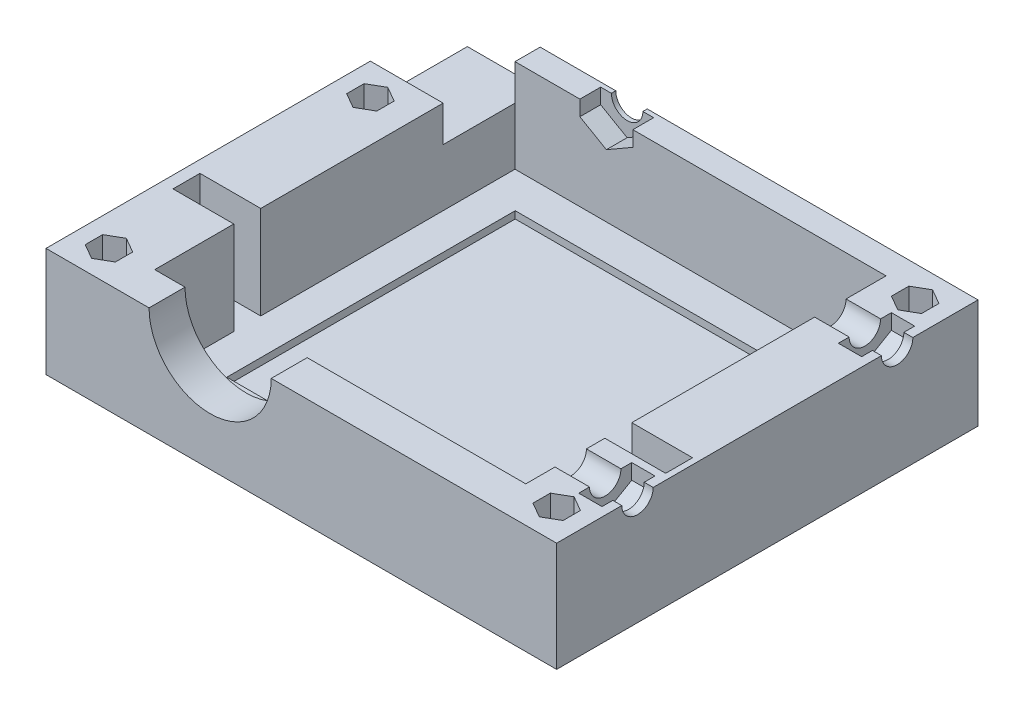
from build123d import *

# Parameters (mm, degrees)
SKETCH1_W              = 56.8325
SKETCH1_H              = 46.9000078
BOSS_EXTRUDE1_DEPTH    = 12.1700036
SKETCH2_W              = 41.2999936
SKETCH2_H              = 40.099996
CUT_EXTRUDE1_DEPTH     = 10.3700072
SKETCH3_W              = 33.3000096
SKETCH3_H              = 32.100012
CUT_EXTRUDE2_DEPTH     = 0.7999984
SKETCH4_W              = 8.1000092
SKETCH4_H              = 10.8000038
CUT_EXTRUDE3_DEPTH     = 3.999992
CUT_EXTRUDE4_START     = -10.3700072
CUT_EXTRUDE4_OUTLINE_W = 6.7650106
CUT_EXTRUDE4_OUTLINE_H = 2.999994
CUT_EXTRUDE4_DEPTH     = 10.3700072
SKETCH6_W              = 6.7650106
SKETCH6_H              = 2.999994
CUT_EXTRUDE5_DEPTH     = 10.3700072
CUT_EXTRUDE6_DEPTH     = 3.999992
CUT_EXTRUDE7_DEPTH     = 5.2500022
SKETCH9_R              = 1.270176684
SKETCH9_R_2            = 1.270176657
CUT_EXTRUDE8_DEPTH     = 38.486962618
CUT_EXTRUDE10_DEPTH    = 2.3114
CUT_EXTRUDE11_DEPTH    = 0.4886198
CUT_EXTRUDE12_DEPTH    = 7.4324972
SKETCH14_W             = 2.5908
SKETCH14_H             = 5.8999882
CUT_EXTRUDE13_DEPTH    = 1.7031716
CUT_EXTRUDE15_DEPTH    = 2.5908


# Read off the part's stored shape, not the designer's step: Cut-Extrude4
with BuildPart() as part:
    # Sketch1 → Boss-Extrude1 (new body)
    with BuildSketch(Plane(origin=(0, 0, 0), x_dir=(1, 0, 0), z_dir=(0, 1, 0))):
        Rectangle(SKETCH1_W, SKETCH1_H)
    extrude(amount=BOSS_EXTRUDE1_DEPTH)

    # Sketch2 → Cut-Extrude1 (cut)
    with BuildSketch(Plane(origin=(0, 12.1700036, 0), x_dir=(1, 0, 0), z_dir=(0, 1, 0))):
        with Locations((0.333756, 0.5999861)):
            Rectangle(SKETCH2_W, SKETCH2_H)
    extrude(amount=-CUT_EXTRUDE1_DEPTH, mode=Mode.SUBTRACT)

    # Sketch3 → Cut-Extrude2 (cut)
    with BuildSketch(Plane(origin=(0, 1.7999964, 0), x_dir=(1, 0, 0), z_dir=(0, 1, 0))):
        with Locations((0.345948, 0.6121781)):
            Rectangle(SKETCH3_W, SKETCH3_H)
    extrude(amount=-CUT_EXTRUDE2_DEPTH, mode=Mode.SUBTRACT)

    # Sketch4 → Cut-Extrude3 (cut)
    with BuildSketch(Plane(origin=(0, 12.1700036, 0), x_dir=(1, 0, 0), z_dir=(0, 1, 0))):
        with Locations((-24.3662454, 18.050002)):
            Rectangle(SKETCH4_W, SKETCH4_H)
    extrude(amount=-CUT_EXTRUDE3_DEPTH, mode=Mode.SUBTRACT)

    # Cut-Extrude4 outline → Cut-Extrude4 (cut)
    with BuildSketch(Plane(origin=(0, 12.1700036, 0), x_dir=(1, 0, 0), z_dir=(0, 1, 0)).offset(CUT_EXTRUDE4_START)):
        with Locations((-23.6987461, -9.1500071)):
            Rectangle(CUT_EXTRUDE4_OUTLINE_W, CUT_EXTRUDE4_OUTLINE_H)
    extrude(amount=CUT_EXTRUDE4_DEPTH, mode=Mode.SUBTRACT)

    # Sketch6 → Cut-Extrude5 (cut)
    with BuildSketch(Plane(origin=(0, 12.1700036, 0), x_dir=(1, 0, 0), z_dir=(0, 1, 0))):
        with Locations((24.3662581, -9.1500071)):
            Rectangle(SKETCH6_W, SKETCH6_H)
    extrude(amount=-CUT_EXTRUDE5_DEPTH, mode=Mode.SUBTRACT)

    # Sketch7 → Cut-Extrude6 (cut)
    with BuildSketch(Plane.XY.offset(23.4500039)):
        with BuildLine():
            Line((-3.3462468, 12.1700036), (-16.946245, 12.1700036))
            ThreePointArc((-16.946245, 12.1700036), (-10.1462459, 5.3699918), (-3.3462468, 12.1700036))
        make_face()
    extrude(amount=-CUT_EXTRUDE6_DEPTH, mode=Mode.SUBTRACT)

    # Sketch8 → Cut-Extrude7 (cut)
    with BuildSketch(Plane(origin=(0, 12.1700036, 0), x_dir=(1, 0, 0), z_dir=(0, 1, 0))):
        Polygon((-24.916257, -18.0069617), (-26.591255007, -18.97402225), (-26.591255007, -20.90814335), (-24.916257, -21.8752039), (-23.241258993, -20.90814335), (-23.241258993, -18.97402225), align=None)
        Polygon((-24.916257, 11.0930309), (-26.591255007, 10.12597035), (-26.591255007, 8.19184925), (-24.916257, 7.2247887), (-23.241258993, 8.19184925), (-23.241258993, 10.12597035), align=None)
        Polygon((24.9162316, 21.8930347), (23.241233593, 20.92597415), (23.241233593, 18.99185305), (24.9162316, 18.0247925), (26.591229607, 18.99185305), (26.591229607, 20.92597415), align=None)
        Polygon((24.9162316, -18.0069617), (23.241233593, -18.97402225), (23.241233593, -20.90814335), (24.9162316, -21.8752039), (26.591229607, -20.90814335), (26.591229607, -18.97402225), align=None)
    extrude(amount=-CUT_EXTRUDE7_DEPTH, mode=Mode.SUBTRACT)

    # Sketch9 → Cut-Extrude8 (cut, through all)
    with BuildSketch(Plane(origin=(0, 6.9200014, 0), x_dir=(1, 0, 0), z_dir=(0, 1, 0))):
        with Locations(Location((-24.875109, 9.1588971, 0), (0, 0, 270))):
            Circle(SKETCH9_R)
        with Locations(Location((-24.916257, -19.9410828, 0), (0, 0, 270))):
            Circle(SKETCH9_R_2)
        with Locations(Location((24.9162316, -19.9410828, 0), (0, 0, 270))):
            Circle(SKETCH9_R_2)
        with Locations(Location((24.9162316, 19.9589136, 0), (0, 0, 270))):
            Circle(SKETCH9_R_2)
    extrude(amount=-CUT_EXTRUDE8_DEPTH, mode=Mode.SUBTRACT)

    # Sketch11 → Cut-Extrude10 (cut)
    with BuildSketch(Plane.XY.offset(-20.6499841)):
        Polygon((-13.093837264, 10.4681909), (-10.1462332, 8.7663909), (-7.198629136, 10.4681909), (-7.198629136, 13.8717909), (-10.1462332, 15.5735909), (-13.093837264, 13.8717909), align=None)
    extrude(amount=-CUT_EXTRUDE10_DEPTH, mode=Mode.SUBTRACT)

    # Sketch12 → Cut-Extrude11 (cut)
    with BuildSketch(Plane.XY.offset(-22.9613841)):
        with BuildLine():
            ThreePointArc((-8.3962367, 12.1700036), (-10.1462332, 13.9200001), (-11.8962297, 12.1700036))
            Line((-11.8962297, 12.1700036), (-8.3962367, 12.1700036))
        make_face()
        with BuildLine():
            Line((-8.3962367, 12.1700036), (-11.8962297, 12.1700036))
            ThreePointArc((-11.8962297, 12.1700036), (-10.1462332, 10.4200071), (-8.3962367, 12.1700036))
        make_face()
    extrude(amount=-CUT_EXTRUDE11_DEPTH, mode=Mode.SUBTRACT)

    # Sketch13 → Cut-Extrude12 (cut)
    with BuildSketch(Plane(origin=(28.41625, 0, 0), x_dir=(0, 0, -1), z_dir=(1, 0, 0))):
        with BuildLine():
            ThreePointArc((16.1999803, 12.1700036), (14.4499838, 13.9200001), (12.6999873, 12.1700036))
            Line((12.6999873, 12.1700036), (16.1999803, 12.1700036))
        make_face()
        with BuildLine():
            Line((16.1999803, 12.1700036), (12.6999873, 12.1700036))
            ThreePointArc((12.6999873, 12.1700036), (14.4499838, 10.4200071), (16.1999803, 12.1700036))
        make_face()
        with BuildLine():
            Line((-16.2000057, 12.1700036), (-12.7000127, 12.1700036))
            ThreePointArc((-12.7000127, 12.1700036), (-14.4500092, 13.9200001), (-16.2000057, 12.1700036))
        make_face()
        with BuildLine():
            ThreePointArc((-16.2000057, 12.1700036), (-14.4500092, 10.4200071), (-12.7000127, 12.1700036))
            Line((-12.7000127, 12.1700036), (-16.2000057, 12.1700036))
        make_face()
    extrude(amount=-CUT_EXTRUDE12_DEPTH, mode=Mode.SUBTRACT)

    # Sketch14 → Cut-Extrude13 (cut)
    with BuildSketch(Plane(origin=(0, 12.1700036, 0), x_dir=(1, 0, 0), z_dir=(0, 1, 0))):
        with Locations((26.120852, -14.4500092)):
            Rectangle(SKETCH14_W, SKETCH14_H)
    extrude(amount=-CUT_EXTRUDE13_DEPTH, mode=Mode.SUBTRACT)

    # Sketch16 → Cut-Extrude15 (cut)
    with BuildSketch(Plane.ZY.offset(-27.416252)):
        with BuildLine():
            Line((14.4500092, 8.763635), (17.4000033, 10.466832))
            Line((17.4000033, 10.466832), (14.852121437, 10.466832))
            ThreePointArc((14.852121437, 10.466832), (15.822266967, 11.084003429), (16.2000057, 12.1700036))
            Line((16.2000057, 12.1700036), (11.5000151, 12.1700036))
            Line((11.5000151, 12.1700036), (11.5000151, 10.466832))
            Line((11.5000151, 10.466832), (14.4500092, 8.763635))
        make_face()
        Polygon((-17.3999779, 12.1700036), (-17.3999779, 10.466832), (-14.4499838, 8.763635), (-11.4999897, 10.466832), (-11.4999897, 12.1700036), align=None)
    extrude(amount=CUT_EXTRUDE15_DEPTH, mode=Mode.SUBTRACT)


solid = part.part
